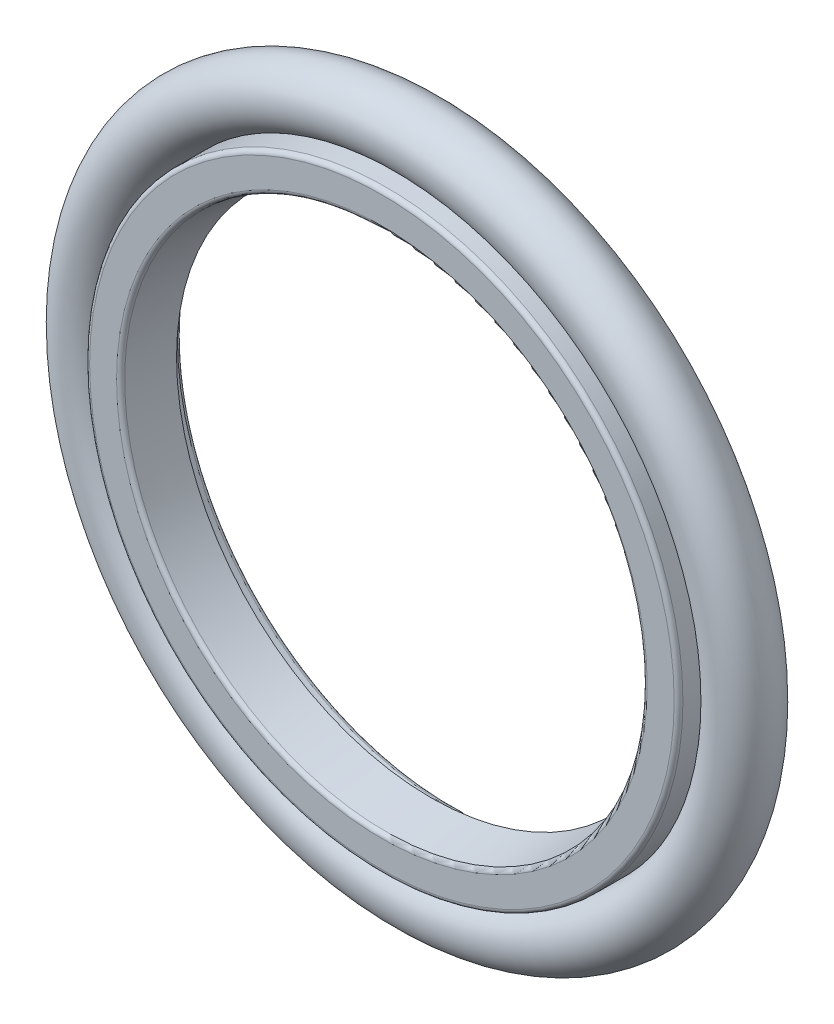
from build123d import *

# Parameters (mm, degrees)
SKETCH2_R = 1.75


with BuildPart() as part:
    # Sketch1 → Revolve1 (revolve)
    with BuildSketch(Plane(origin=(0, 0, 0), x_dir=(0, 0, -1), z_dir=(1, 0, 0))):
        with BuildLine():
            Line((0.25, 16.9), (3.75, 16.9))
            ThreePointArc((3.75, 16.9), (3.926776695, 16.826776695), (4, 16.65))
            Line((4, 16.65), (4, 15.65))
            ThreePointArc((4, 15.65), (3.926776695, 15.473223305), (3.75, 15.4))
            Line((3.75, 15.4), (3.2, 15.4))
            Line((3.2, 15.4), (2.8, 14.5))
            Line((2.8, 14.5), (0.214644661, 14.869336477))
            ThreePointArc((0.214644661, 14.869336477), (0.061136511, 14.953023415), (0, 15.11682385))
            Line((0, 15.11682385), (0, 16.65))
            ThreePointArc((0, 16.65), (0.073223305, 16.826776695), (0.25, 16.9))
        make_face()
    revolve(axis=Axis((0, 0, 0), (0, 0, -1)))


with BuildPart() as body_2:
    # Sketch2 → Revolve2 (revolve)
    with BuildSketch(Plane(origin=(0, 0, 0), x_dir=(0, 0, -1), z_dir=(1, 0, 0))):
        with Locations((2, 18.65)):
            Circle(SKETCH2_R)
    revolve(axis=Axis((0, 0, 0), (0, 0, -1)))


solid = Compound([part.part, body_2.part])
